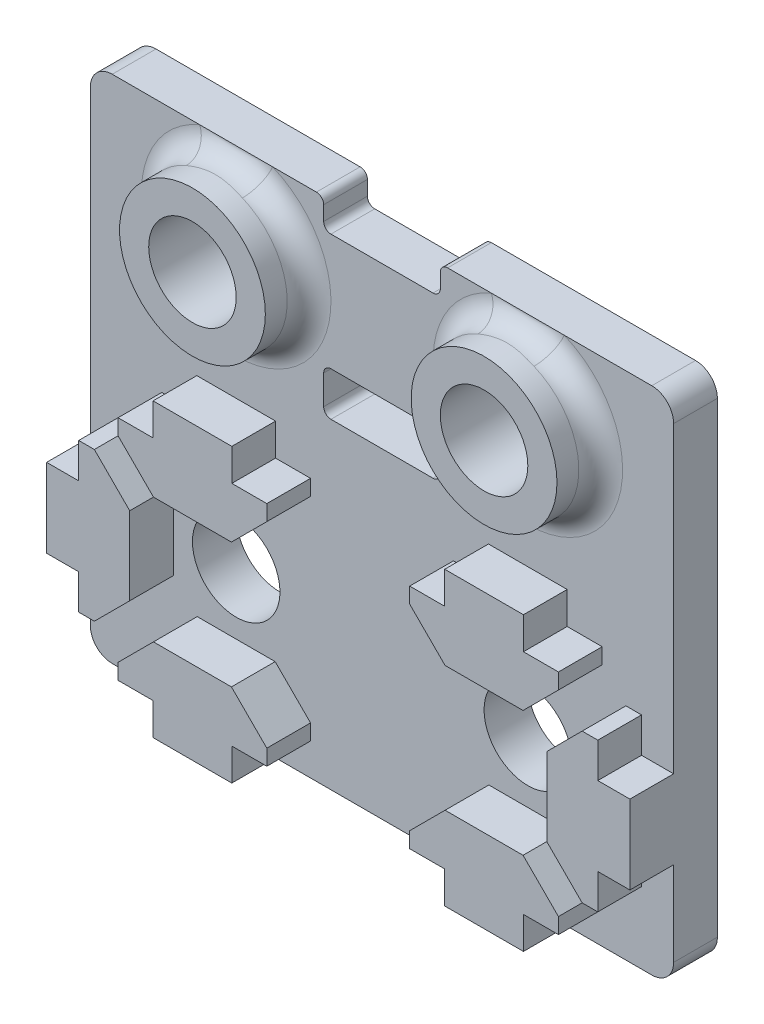
from build123d import *
from build123d.topology import SkipClean

# Parameters (mm, degrees)
SKETCH_1_W          = 40
SKETCH_1_H          = 20
EXTRUDE_1_DEPTH     = 3
EXTRUDE_2_DEPTH     = 3
SKETCH_3_R          = 3
CUT_EXTRUDE_1_DEPTH = 3
SKETCH_4_W          = 40
SKETCH_4_H          = 15
SKETCH_4_R          = 3
EXTRUDE_3_DEPTH     = 3
FILLET_3_R          = 1.5
SKETCH_5_R          = 5
SKETCH_5_R_2        = 3
EXTRUDE_4_DEPTH     = 3
FILLET_4_R          = 1.5
CUT_EXTRUDE_2_DEPTH = 10
FILLET_6_R          = 0.5
CUT_EXTRUDE_3_DEPTH = 3


with BuildPart() as part:
    # 草图1 → 凸台-拉伸1 (new body)
    with BuildSketch(Plane.XY):
        Rectangle(SKETCH_1_W, SKETCH_1_H)
    extrude(amount=EXTRUDE_1_DEPTH)

    # 草图2 → 凸台-拉伸2 (add)
    with BuildSketch(Plane.XY.offset(3)):
        Polygon((-6.9, 8.2), (-6.9, 10), (-13.1, 10), (-13.1, 8.2), (-15.5, 8.2), (-15.5, 6.560660172), (-12.839339828, 3.9), (-7.160660172, 3.9), (-4.5, 6.560660172), (-4.5, 8.2), align=None)
        Polygon((-16.560660172, 5.5), (-18.2, 5.5), (-18.2, 3.1), (-20, 3.1), (-20, -3.1), (-18.2, -3.1), (-18.2, -5.5), (-16.560660172, -5.5), (-13.9, -2.839339828), (-13.9, 2.839339828), align=None)
        Polygon((-12.839339828, -3.9), (-7.160660172, -3.9), (-4.5, -6.560660172), (-4.5, -8.2), (-6.9, -8.2), (-6.9, -10), (-13.1, -10), (-13.1, -8.2), (-15.5, -8.2), (-15.5, -6.560660172), align=None)
        Polygon((18.2, 3.1), (20, 3.1), (20, -3.1), (18.2, -3.1), (18.2, -5.5), (16.560660172, -5.5), (13.9, -2.839339828), (13.9, 2.839339828), (16.560660172, 5.5), (18.2, 5.5), align=None)
        Polygon((13.1, 8.2), (13.1, 10), (6.9, 10), (6.9, 8.2), (4.5, 8.2), (4.5, 6.560660172), (7.160660172, 3.9), (12.839339828, 3.9), (15.5, 6.560660172), (15.5, 8.2), align=None)
        Polygon((7.160660172, -3.9), (12.839339828, -3.9), (15.5, -6.560660172), (15.5, -8.2), (13.1, -8.2), (13.1, -10), (6.9, -10), (6.9, -8.2), (4.5, -8.2), (4.5, -6.560660172), align=None)
    extrude(amount=EXTRUDE_2_DEPTH)

    # 草图3 → 切除-拉伸1 (cut)
    with BuildSketch(Plane(origin=(0, 0, 0), x_dir=(-1, 0, 0), z_dir=(0, 0, -1))):
        with Locations((-10, 0)):
            Circle(SKETCH_3_R)
        with Locations((10, 0)):
            Circle(SKETCH_3_R)
    extrude(amount=-CUT_EXTRUDE_1_DEPTH, mode=Mode.SUBTRACT)

    # 草图4 → 凸台-拉伸3 (add)
    with BuildSketch(Plane(origin=(0, 0, 0), x_dir=(-1, 0, 0), z_dir=(0, 0, -1))):
        with Locations((0, 17.5)):
            Rectangle(SKETCH_4_W, SKETCH_4_H)
        with Locations((-10, 19)):
            Circle(SKETCH_4_R, mode=Mode.SUBTRACT)
        with Locations((10, 19)):
            Circle(SKETCH_4_R, mode=Mode.SUBTRACT)
    extrude(amount=-EXTRUDE_3_DEPTH)

    # 圆角3
    fillet_3_edges = [part.edges().sort_by_distance(p)[0] for p in [
        (20, -10, 1.5),
        (-20, -10, 1.5),
        (20, 25, 1.5),
        (-20, 25, 1.5),
    ]]
    fillet(fillet_3_edges, radius=FILLET_3_R)

    # 草图5 → 凸台-拉伸4 (add)
    # profile 1 of 2: a face of its own
    with SkipClean():  # the faces are left unmerged after this step: merging them gives an invalid solid
        with BuildSketch(Plane.XY.offset(3)):
            with Locations((-10, 19)):
                Circle(SKETCH_5_R)
            with Locations((-10, 19)):
                Circle(SKETCH_5_R_2, mode=Mode.SUBTRACT)
        # profile 2 of 2: a face of its own
        with BuildSketch(Plane.XY.offset(3)):
            with Locations((10, 19)):
                Circle(SKETCH_5_R)
            with Locations((10, 19)):
                Circle(SKETCH_5_R_2, mode=Mode.SUBTRACT)
        extrude(amount=EXTRUDE_4_DEPTH)
    add(part.part.scale(1), mode=Mode.REPLACE)  # the faces are merged on a copy

    # 圆角4
    fillet_4_edges = [part.edges().sort_by_distance(p)[0] for p in [
        (5, 19, 3),
        (-15, 19, 3),
    ]]
    fillet(fillet_4_edges, radius=FILLET_4_R)

    # 草图6 → 切除-拉伸2 (cut)
    with BuildSketch(Plane(origin=(0, 0, 0), x_dir=(-1, 0, 0), z_dir=(0, 0, -1))):
        Polygon((0, 23.005790595), (4, 23.005790595), (4, 25), (-4, 25), (-4, 23.005790595), align=None)
        Polygon((0, 15.005790595), (-4, 15.005790595), (-4, 12.005790595), (4, 12.005790595), (4, 15.005790595), align=None)
    extrude(amount=-CUT_EXTRUDE_2_DEPTH, mode=Mode.SUBTRACT)

    # 圆角6
    fillet_6_edges = [part.edges().sort_by_distance(p)[0] for p in [
        (4, 23.005790595, 1.5),
        (-4, 23.005790595, 1.5),
        (4, 25, 1.5),
        (-4, 25, 1.5),
        (4, 15.005790595, 1.5),
        (4, 12.005790595, 1.5),
        (-4, 12.005790595, 1.5),
        (-4, 15.005790595, 1.5),
    ]]
    fillet(fillet_6_edges, radius=FILLET_6_R)

    # 草图7 → 切除-拉伸3 (cut)
    with BuildSketch(Plane.XY.offset(6)):
        Polygon((-18.2, -3.1), (-18.2, -5.5), (-16.560660172, -5.5), (-13.9, -2.839339828), (-13.9, 2.839339828), (-16.560660172, 5.5), (-18.2, 5.5), (-18.2, 3.1), (-20, 3.1), (-20, 2.7), (-19.6, 2.7), (-17.8, 2.7), (-17.8, 5.1), (-16.726345597, 5.1), (-14.3, 2.673654403), (-14.3, -2.673654403), (-16.726345597, -5.1), (-17.8, -5.1), (-17.8, -2.7), (-19.6, -2.7), (-20, -2.7), (-20, -3.1), align=None)
        Polygon((-12.839339828, -3.9), (-15.5, -6.560660172), (-15.5, -8.2), (-13.1, -8.2), (-13.1, -10), (-12.7, -10), (-12.7, -9.6), (-12.7, -7.8), (-15.1, -7.8), (-15.1, -6.726345597), (-12.673654403, -4.3), (-7.326345597, -4.3), (-4.9, -6.726345597), (-4.9, -7.8), (-7.3, -7.8), (-7.3, -9.6), (-7.3, -10), (-6.9, -10), (-6.9, -8.2), (-4.5, -8.2), (-4.5, -6.560660172), (-7.160660172, -3.9), align=None)
        Polygon((-4.5, 8.2), (-6.9, 8.2), (-6.9, 10), (-7.3, 10), (-7.3, 9.6), (-7.3, 7.8), (-4.9, 7.8), (-4.9, 6.726345597), (-7.326345597, 4.3), (-12.673654403, 4.3), (-15.1, 6.726345597), (-15.1, 7.8), (-12.7, 7.8), (-12.7, 9.6), (-12.7, 10), (-13.1, 10), (-13.1, 8.2), (-15.5, 8.2), (-15.5, 6.560660172), (-12.839339828, 3.9), (-7.160660172, 3.9), (-4.5, 6.560660172), align=None)
        Polygon((15.5, 8.2), (13.1, 8.2), (13.1, 10), (12.7, 10), (12.7, 9.6), (12.7, 7.8), (15.1, 7.8), (15.1, 6.726345597), (12.673654403, 4.3), (7.326345597, 4.3), (4.9, 6.726345597), (4.9, 7.8), (7.3, 7.8), (7.3, 9.6), (7.3, 10), (6.9, 10), (6.9, 8.2), (4.5, 8.2), (4.5, 6.560660172), (7.160660172, 3.9), (12.839339828, 3.9), (15.5, 6.560660172), align=None)
        Polygon((18.2, 3.1), (18.2, 5.5), (16.560660172, 5.5), (13.9, 2.839339828), (13.9, -2.839339828), (16.560660172, -5.5), (18.2, -5.5), (18.2, -3.1), (20, -3.1), (20, -2.7), (19.6, -2.7), (17.8, -2.7), (17.8, -5.1), (16.726345597, -5.1), (14.3, -2.673654403), (14.3, 2.673654403), (16.726345597, 5.1), (17.8, 5.1), (17.8, 2.7), (19.6, 2.7), (20, 2.7), (20, 3.1), align=None)
        Polygon((7.160660172, -3.9), (4.5, -6.560660172), (4.5, -8.2), (6.9, -8.2), (6.9, -10), (7.3, -10), (7.3, -9.6), (7.3, -7.8), (4.9, -7.8), (4.9, -6.726345597), (7.326345597, -4.3), (12.673654403, -4.3), (15.1, -6.726345597), (15.1, -7.8), (12.7, -7.8), (12.7, -9.6), (12.7, -10), (13.1, -10), (13.1, -8.2), (15.5, -8.2), (15.5, -6.560660172), (12.839339828, -3.9), align=None)
    extrude(amount=-CUT_EXTRUDE_3_DEPTH, mode=Mode.SUBTRACT)


solid = part.part
